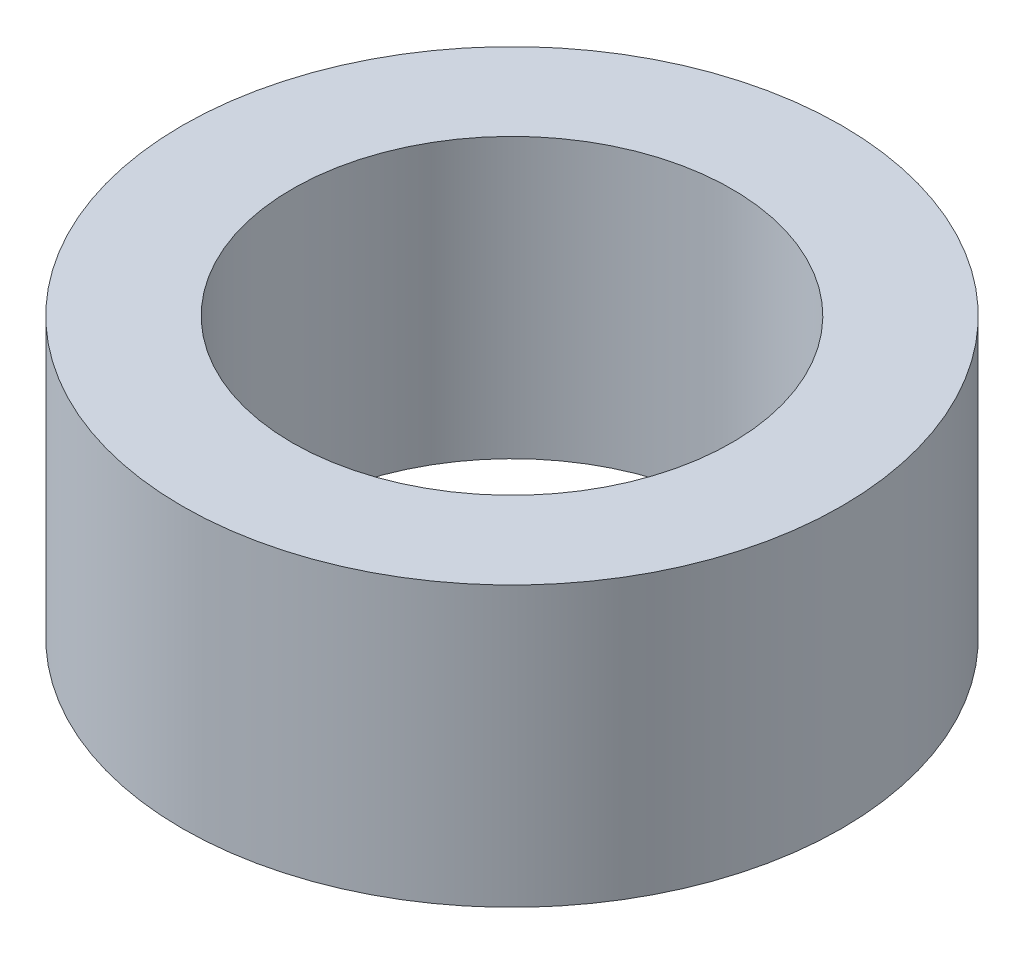
from build123d import *

# Parameters (mm, degrees)
SKETCH1_R           = 15
SKETCH1_R_2         = 10
BOSS_EXTRUDE1_DEPTH = 12.7


with BuildPart() as part:
    # Sketch1 → Boss-Extrude1 (new body)
    with BuildSketch(Plane(origin=(0, 0, 0), x_dir=(1, 0, 0), z_dir=(0, 1, 0))):
        Circle(SKETCH1_R)
        Circle(SKETCH1_R_2, mode=Mode.SUBTRACT)
    extrude(amount=BOSS_EXTRUDE1_DEPTH)


solid = part.part
